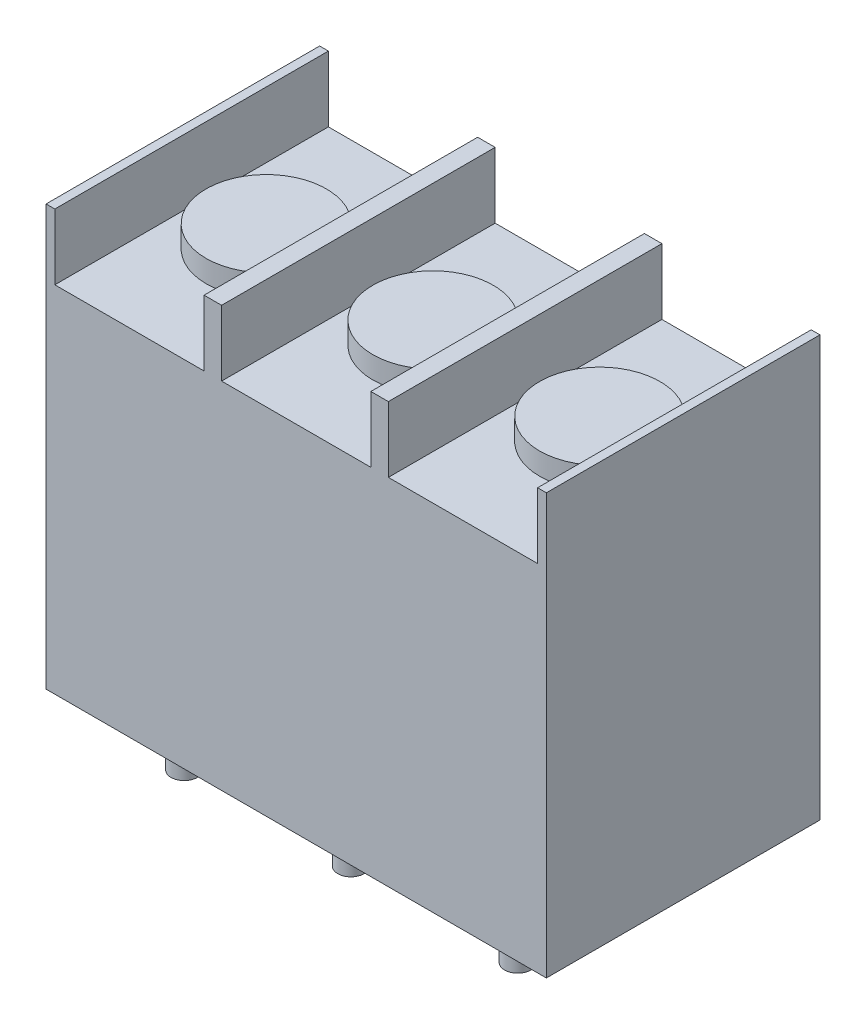
from build123d import *

# Parameters (mm, degrees)
SKETCH_1_W          = 22.86
SKETCH_1_H          = 12.5
EXTRUDE_1_DEPTH     = 19.2
SKETCH_2_W          = 6.82
SKETCH_2_H          = 12.5
CUT_EXTRUDE_1_DEPTH = 3
SKETCH_3_R          = 0.6
EXTRUDE_2_DEPTH     = 2.54
SKETCH_4_R          = 2.75
EXTRUDE_3_DEPTH     = 1


with BuildPart() as part:
    # 草图1 → 拉伸1 (new body)
    with BuildSketch(Plane(origin=(0, 0, 0), x_dir=(1, 0, 0), z_dir=(0, 1, 0))):
        Rectangle(SKETCH_1_W, SKETCH_1_H)
    extrude(amount=EXTRUDE_1_DEPTH)

    # 草图2 → 切除-拉伸1 (cut)
    with BuildSketch(Plane(origin=(0, 19.2, 0), x_dir=(-1, 0, 0), z_dir=(0, 1, 0))):
        with Locations((-7.62, 0)):
            Rectangle(SKETCH_2_W, SKETCH_2_H)
        Rectangle(SKETCH_2_W, SKETCH_2_H)
        with Locations((7.62, 0)):
            Rectangle(SKETCH_2_W, SKETCH_2_H)
    extrude(amount=-CUT_EXTRUDE_1_DEPTH, mode=Mode.SUBTRACT)

    # 草图3 → 拉伸2 (add)
    with BuildSketch(Plane.XZ):
        with Locations((0, 3.75)):
            Circle(SKETCH_3_R)
        with Locations((7.62, 3.75)):
            Circle(SKETCH_3_R)
        with Locations((-7.62, 3.75)):
            Circle(SKETCH_3_R)
    extrude(amount=EXTRUDE_2_DEPTH)

    # 草图4 → 拉伸3 (add)
    with BuildSketch(Plane(origin=(0, 16.2, 0), x_dir=(-1, 0, 0), z_dir=(0, 1, 0))):
        Circle(SKETCH_4_R)
        with Locations((7.62, 0)):
            Circle(SKETCH_4_R)
        with Locations((-7.62, 0)):
            Circle(SKETCH_4_R)
    extrude(amount=EXTRUDE_3_DEPTH)


solid = part.part
